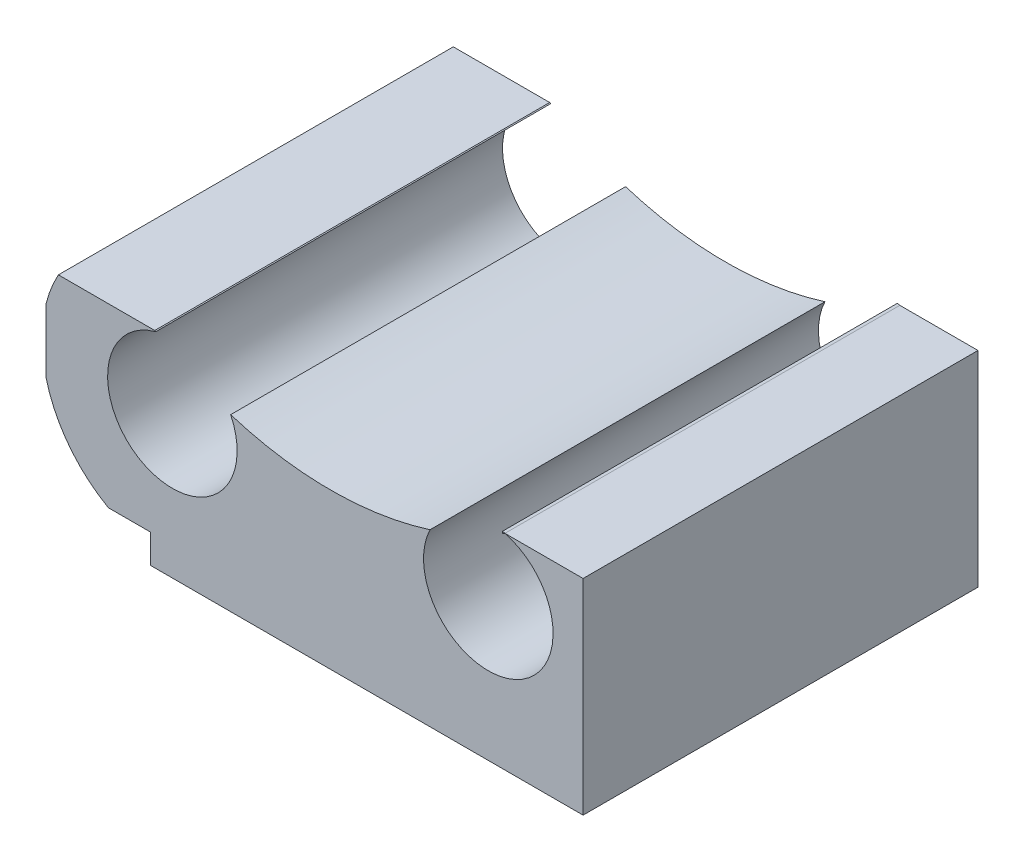
from build123d import *

# Parameters (mm, degrees)
BOSS_EXTRUDE1_DEPTH = 18
CUT_EXTRUDE3_DEPTH  = 88.315519812
BOSS_EXTRUDE2_DEPTH = 15.1
CUT_EXTRUDE5_START  = -40
CUT_EXTRUDE5_DEPTH  = 80
SKETCH11_W          = 45
SKETCH11_H          = 50
CUT_EXTRUDE8_DEPTH  = 35
SKETCH12_W          = 14.945990499
SKETCH12_H          = 30.355219796
CUT_EXTRUDE9_DEPTH  = 70
SKETCH13_W          = 12.4
SKETCH13_H          = 25
BOSS_EXTRUDE3_DEPTH = 7
SKETCH14_W          = 10
SKETCH14_H          = 12.97776887
CUT_EXTRUDE10_DEPTH = 40
SKETCH15_W          = 25
SKETCH15_H          = 1.827543594
BOSS_EXTRUDE4_DEPTH = 25
SKETCH17_W          = 5
SKETCH17_H          = 25
BOSS_EXTRUDE5_DEPTH = 5
CUT_EXTRUDE11_DEPTH = 15
SKETCH19_R          = 0.9
CUT_EXTRUDE12_DEPTH = 15


# Read off the part's stored shape, not the designer's step: Cut-Extrude5
with BuildPart() as part:
    # Sketch2 → Boss-Extrude1 (new, symmetric)
    with BuildSketch(Plane(origin=(0, 0, 0), x_dir=(0, 0, -1), z_dir=(1, 0, 0))):
        Polygon((-40, -26.817424229), (-40, -17.817424229), (40, -17.817424229), (40, -26.817424229), (0, -30), align=None)
    extrude(amount=BOSS_EXTRUDE1_DEPTH, both=True)

    # Sketch3 → Cut-Extrude3 (cut, through all)
    with BuildSketch(Plane.XY.offset(40)):
        with BuildLine():
            Line((-16.562202374, -26.817424229), (-18, -26.817424229))
            Line((-18, -26.817424229), (-18, -30.067424229))
            Line((-18, -30.067424229), (-10, -30.067424229))
            ThreePointArc((-10, -30.067424229), (-13.661454629, -29.210410771), (-16.562202374, -26.817424229))
        make_face()
        with BuildLine():
            ThreePointArc((-16.562202374, -26.817424229), (-17.432438927, -25.398115726), (-18, -23.832988666))
            Line((-18, -23.832988666), (-18, -26.817424229))
            Line((-18, -26.817424229), (-16.562202374, -26.817424229))
        make_face()
        with BuildLine():
            Line((-17.215434845, -17.817424229), (-18, -17.817424229))
            Line((-18, -17.817424229), (-18, -19.801859792))
            ThreePointArc((-18, -19.801859792), (-17.672148363, -18.784168636), (-17.215434845, -17.817424229))
        make_face()
        with BuildLine():
            ThreePointArc((16.562202374, -26.817424229), (13.661454629, -29.210410771), (10, -30.067424229))
            Line((10, -30.067424229), (18, -30.067424229))
            Line((18, -30.067424229), (18, -26.817424229))
            Line((18, -26.817424229), (16.562202374, -26.817424229))
        make_face()
        with BuildLine():
            ThreePointArc((10.138510435, -17.817424229), (10.216403484, -17.772875396), (10.294100789, -17.727986037))
            ThreePointArc((10.294100789, -17.727986037), (9.693767636, -17.728876597), (9.1, -17.817424229))
            Line((9.1, -17.817424229), (10.138510435, -17.817424229))
        make_face()
        with BuildLine():
            ThreePointArc((10.9, -17.817424229), (10.598722783, -17.761375533), (10.294100789, -17.727986037))
            ThreePointArc((10.294100789, -17.727986037), (10.216403484, -17.772875396), (10.138510435, -17.817424229))
            Line((10.138510435, -17.817424229), (10.9, -17.817424229))
        make_face()
        with BuildLine():
            Line((10.138510435, -17.817424229), (9.1, -17.817424229))
            ThreePointArc((9.1, -17.817424229), (7.76570517, -18.379703093), (6.710065877, -19.370725746))
            ThreePointArc((6.710065877, -19.370725746), (8.460012845, -18.672926462), (10.138510435, -17.817424229))
        make_face()
        with BuildLine():
            ThreePointArc((14.1, -21.817424229), (13.201562119, -19.256174534), (10.9, -17.817424229))
            Line((10.9, -17.817424229), (10.138510435, -17.817424229))
            ThreePointArc((10.138510435, -17.817424229), (8.460012845, -18.672926462), (6.710065877, -19.370725746))
            ThreePointArc((6.710065877, -19.370725746), (8.711343704, -25.709642742), (14.1, -21.817424229))
        make_face()
        with BuildLine():
            Line((-10.138510435, -17.817424229), (-10.9, -17.817424229))
            ThreePointArc((-10.9, -17.817424229), (-12.561249695, -25.018986348), (-5.9, -21.817424229))
            ThreePointArc((-5.9, -21.817424229), (-6.107781487, -20.528767934), (-6.710065877, -19.370725746))
            ThreePointArc((-6.710065877, -19.370725746), (-8.460012845, -18.672926462), (-10.138510435, -17.817424229))
        make_face()
        with BuildLine():
            ThreePointArc((-10.294100789, -17.727986037), (-10.598722783, -17.761375533), (-10.9, -17.817424229))
            Line((-10.9, -17.817424229), (-10.138510435, -17.817424229))
            ThreePointArc((-10.138510435, -17.817424229), (-10.216403484, -17.772875396), (-10.294100789, -17.727986037))
        make_face()
        with BuildLine():
            ThreePointArc((-9.1, -17.817424229), (-9.693767636, -17.728876597), (-10.294100789, -17.727986037))
            ThreePointArc((-10.294100789, -17.727986037), (-10.216403484, -17.772875396), (-10.138510435, -17.817424229))
            Line((-10.138510435, -17.817424229), (-9.1, -17.817424229))
        make_face()
        with BuildLine():
            Line((-9.1, -17.817424229), (-10.138510435, -17.817424229))
            ThreePointArc((-10.138510435, -17.817424229), (-8.460012845, -18.672926462), (-6.710065877, -19.370725746))
            ThreePointArc((-6.710065877, -19.370725746), (-7.76570517, -18.379703093), (-9.1, -17.817424229))
        make_face()
        with BuildLine():
            ThreePointArc((18, -23.832988666), (17.432438927, -25.398115726), (16.562202374, -26.817424229))
            Line((16.562202374, -26.817424229), (18, -26.817424229))
            Line((18, -26.817424229), (18, -23.832988666))
        make_face()
        with BuildLine():
            ThreePointArc((-14.244209612, -14.742879384), (-15.932458957, -16.084324655), (-17.215434845, -17.817424229))
            Line((-17.215434845, -17.817424229), (-10.9, -17.817424229))
            ThreePointArc((-10.9, -17.817424229), (-10.598722783, -17.761375533), (-10.294100789, -17.727986037))
            ThreePointArc((-10.294100789, -17.727986037), (-12.359606983, -16.355125045), (-14.244209612, -14.742879384))
        make_face()
        with BuildLine():
            ThreePointArc((-2.784565155, -17.817424229), (-7.86218538, -13.849221882), (-14.244209612, -14.742879384))
            ThreePointArc((-14.244209612, -14.742879384), (-12.359606983, -16.355125045), (-10.294100789, -17.727986037))
            ThreePointArc((-10.294100789, -17.727986037), (-9.693767636, -17.728876597), (-9.1, -17.817424229))
            Line((-9.1, -17.817424229), (-2.784565155, -17.817424229))
        make_face()
        with BuildLine():
            ThreePointArc((-1.870156707, -20.414517234), (-2.21825127, -19.077554396), (-2.784565155, -17.817424229))
            Line((-2.784565155, -17.817424229), (-9.1, -17.817424229))
            ThreePointArc((-9.1, -17.817424229), (-7.76570517, -18.379703093), (-6.710065877, -19.370725746))
            ThreePointArc((-6.710065877, -19.370725746), (-4.321739241, -20.039275684), (-1.870156707, -20.414517234))
        make_face()
        with BuildLine():
            ThreePointArc((20.5, 0), (-8.007612096, 18.871357888), (-14.244209612, -14.742879384))
            ThreePointArc((-14.244209612, -14.742879384), (-7.86218538, -13.849221882), (-2.784565155, -17.817424229))
            Line((-2.784565155, -17.817424229), (2.784565155, -17.817424229))
            ThreePointArc((2.784565155, -17.817424229), (7.86218538, -13.849221882), (14.244209612, -14.742879384))
            ThreePointArc((14.244209612, -14.742879384), (18.871357888, -8.007612096), (20.5, 0))
        make_face()
        with BuildLine():
            Line((2.784565155, -17.817424229), (-2.784565155, -17.817424229))
            ThreePointArc((-2.784565155, -17.817424229), (-2.21825127, -19.077554396), (-1.870156707, -20.414517234))
            ThreePointArc((-1.870156707, -20.414517234), (0, -20.5), (1.870156707, -20.414517234))
            ThreePointArc((1.870156707, -20.414517234), (2.21825127, -19.077554396), (2.784565155, -17.817424229))
        make_face()
        with BuildLine():
            ThreePointArc((17.215434845, -17.817424229), (15.932458957, -16.084324655), (14.244209612, -14.742879384))
            ThreePointArc((14.244209612, -14.742879384), (12.359606983, -16.355125045), (10.294100789, -17.727986037))
            ThreePointArc((10.294100789, -17.727986037), (10.598722783, -17.761375533), (10.9, -17.817424229))
            Line((10.9, -17.817424229), (17.215434845, -17.817424229))
        make_face()
        with BuildLine():
            ThreePointArc((10.294100789, -17.727986037), (12.359606983, -16.355125045), (14.244209612, -14.742879384))
            ThreePointArc((14.244209612, -14.742879384), (7.86218538, -13.849221882), (2.784565155, -17.817424229))
            Line((2.784565155, -17.817424229), (9.1, -17.817424229))
            ThreePointArc((9.1, -17.817424229), (9.693767636, -17.728876597), (10.294100789, -17.727986037))
        make_face()
        with BuildLine():
            Line((9.1, -17.817424229), (2.784565155, -17.817424229))
            ThreePointArc((2.784565155, -17.817424229), (2.21825127, -19.077554396), (1.870156707, -20.414517234))
            ThreePointArc((1.870156707, -20.414517234), (4.321739241, -20.039275684), (6.710065877, -19.370725746))
            ThreePointArc((6.710065877, -19.370725746), (7.76570517, -18.379703093), (9.1, -17.817424229))
        make_face()
    extrude(amount=-CUT_EXTRUDE3_DEPTH, mode=Mode.SUBTRACT)

    # Sketch5 → Boss-Extrude2 (add)
    with BuildSketch(Plane(origin=(26, 0, 0), x_dir=(0, 0, -1), z_dir=(1, 0, 0))):
        Polygon((12.5, 12.5), (-12.5, 12.5), (-12.5, 0), (-40, -17.817424229), (-40, -23.832988666), (40, -23.832988666), (40, -17.817424229), (12.5, 0), align=None)
    extrude(amount=-BOSS_EXTRUDE2_DEPTH)

    # Cut-Extrude5 outline → Cut-Extrude5 (cut)
    with BuildSketch(Plane.XY.offset(CUT_EXTRUDE5_START)):
        with BuildLine():
            Line((10.9, -23.832988666), (13.570364127, -23.832988666))
            ThreePointArc((13.570364127, -23.832988666), (13.778840831, -20.226713077), (11.054009501, -17.855219796))
            ThreePointArc((11.054009501, -17.855219796), (10.977106296, -17.902601413), (10.9, -17.949651807))
            Line((10.9, -17.949651807), (10.9, -23.832988666))
        make_face()
        with BuildLine():
            ThreePointArc((-11.114827657, -17.817424229), (-11.084434688, -17.836347935), (-11.054009501, -17.855219796))
            ThreePointArc((-11.054009501, -17.855219796), (-10.977187499, -17.835577347), (-10.9, -17.817424229))
            Line((-10.9, -17.817424229), (-11.114827657, -17.817424229))
        make_face()
        with BuildLine():
            ThreePointArc((-6.310400221, -20.029449544), (0, -21), (6.310400221, -20.029449544))
            ThreePointArc((6.310400221, -20.029449544), (6.494725028, -19.690678506), (6.710065877, -19.370725746))
            ThreePointArc((6.710065877, -19.370725746), (0, -20.5), (-6.710065877, -19.370725746))
            ThreePointArc((-6.710065877, -19.370725746), (-6.494725028, -19.690678506), (-6.310400221, -20.029449544))
        make_face()
        with BuildLine():
            ThreePointArc((10.9, -17.817424229), (10.977187499, -17.835577347), (11.054009501, -17.855219796))
            ThreePointArc((11.054009501, -17.855219796), (20.624276231, -3.954646627), (16.874537031, 12.5))
            Line((16.874537031, 12.5), (10.9, 12.5))
            Line((10.9, 12.5), (10.9, -17.817424229))
        make_face()
    extrude(amount=CUT_EXTRUDE5_DEPTH, mode=Mode.SUBTRACT)

    # Sketch11 → Cut-Extrude8 (cut, symmetric)
    with BuildSketch(Plane(origin=(0, 0, 0), x_dir=(0, 0, -1), z_dir=(1, 0, 0))):
        with Locations((-35, -12.5)):
            Rectangle(SKETCH11_W, SKETCH11_H)
        with Locations((35, -12.5)):
            Rectangle(SKETCH11_W, SKETCH11_H)
    extrude(amount=CUT_EXTRUDE8_DEPTH, both=True, mode=Mode.SUBTRACT)

    # Sketch12 → Cut-Extrude9 (cut)
    with BuildSketch(Plane.XY.offset(12.5)):
        with Locations((18.527004751, -2.677609898)):
            Rectangle(SKETCH12_W, SKETCH12_H)
    extrude(amount=-CUT_EXTRUDE9_DEPTH, mode=Mode.SUBTRACT)

    # Sketch13 → Boss-Extrude3 (add)
    with BuildSketch(Plane.XZ.offset(23.832988666)):
        with Locations((19.8, 0)):
            Rectangle(SKETCH13_W, SKETCH13_H)
    extrude(amount=BOSS_EXTRUDE3_DEPTH)

    # Sketch14 → Cut-Extrude10 (cut)
    with BuildSketch(Plane.XY.offset(12.5)):
        with Locations((21, -24.344104231)):
            Rectangle(SKETCH14_W, SKETCH14_H)
    extrude(amount=-CUT_EXTRUDE10_DEPTH, mode=Mode.SUBTRACT)

    # Sketch15 → Boss-Extrude4 (add)
    with BuildSketch(Plane.ZY.offset(-13.6)):
        with Locations((0, -29.919216869)):
            Rectangle(SKETCH15_W, SKETCH15_H)
    extrude(amount=BOSS_EXTRUDE4_DEPTH)

    # Sketch17 → Boss-Extrude5 (add)
    with BuildSketch(Plane(origin=(0, -30.832988666, 0), x_dir=(-1, 0, 0), z_dir=(0, -1, 0))):
        with Locations((8.5, 0)):
            Rectangle(SKETCH17_W, SKETCH17_H)
    extrude(amount=BOSS_EXTRUDE5_DEPTH)

    # Sketch18 → Cut-Extrude11 (cut)
    with BuildSketch(Plane(origin=(-6, 0, 0), x_dir=(0, 0, -1), z_dir=(1, 0, 0))):
        Polygon((12.5, -30.832988666), (6.5, -35.832988666), (12.5, -35.832988666), align=None)
        Polygon((-6.5, -35.832988666), (-12.5, -35.832988666), (-12.5, -30.832988666), align=None)
    extrude(amount=-CUT_EXTRUDE11_DEPTH, mode=Mode.SUBTRACT)

    # Sketch19 → Cut-Extrude12 (cut)
    with BuildSketch(Plane(origin=(-6, 0, 0), x_dir=(0, 0, -1), z_dir=(1, 0, 0))):
        with Locations((-7.5, -33.332988666)):
            Circle(SKETCH19_R)
        with Locations((-3.75, -33.332988666)):
            Circle(SKETCH19_R)
        with Locations((0, -33.332988666)):
            Circle(SKETCH19_R)
        with Locations((3.75, -33.332988666)):
            Circle(SKETCH19_R)
        with Locations((7.5, -33.332988666)):
            Circle(SKETCH19_R)
    extrude(amount=-CUT_EXTRUDE12_DEPTH, mode=Mode.SUBTRACT)


solid = part.part
